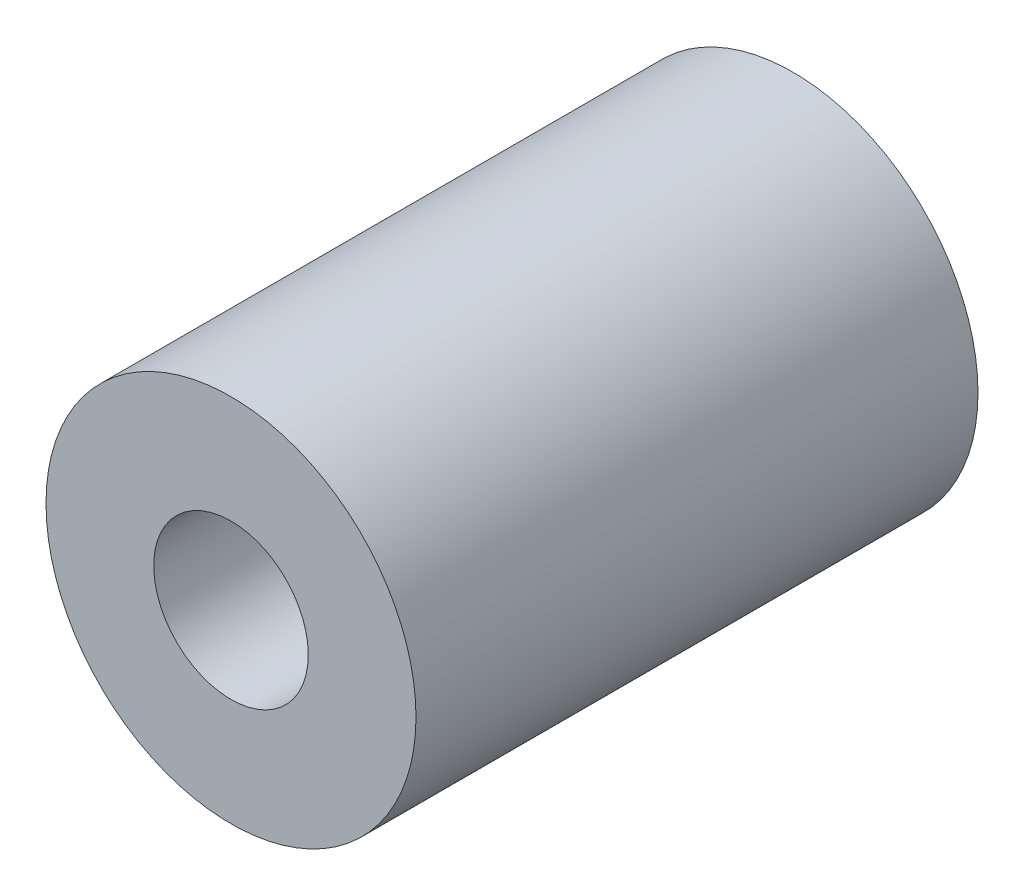
from build123d import *

# Parameters (mm, degrees)
SKETCH1_R           = 3.95
SKETCH1_R_2         = 1.65
BOSS_EXTRUDE1_DEPTH = 6


with BuildPart() as part:
    # Sketch1 → Boss-Extrude1 (new, symmetric)
    with BuildSketch(Plane.XY):
        Circle(SKETCH1_R)
        Circle(SKETCH1_R_2, mode=Mode.SUBTRACT)
    extrude(amount=BOSS_EXTRUDE1_DEPTH, both=True)


solid = part.part
